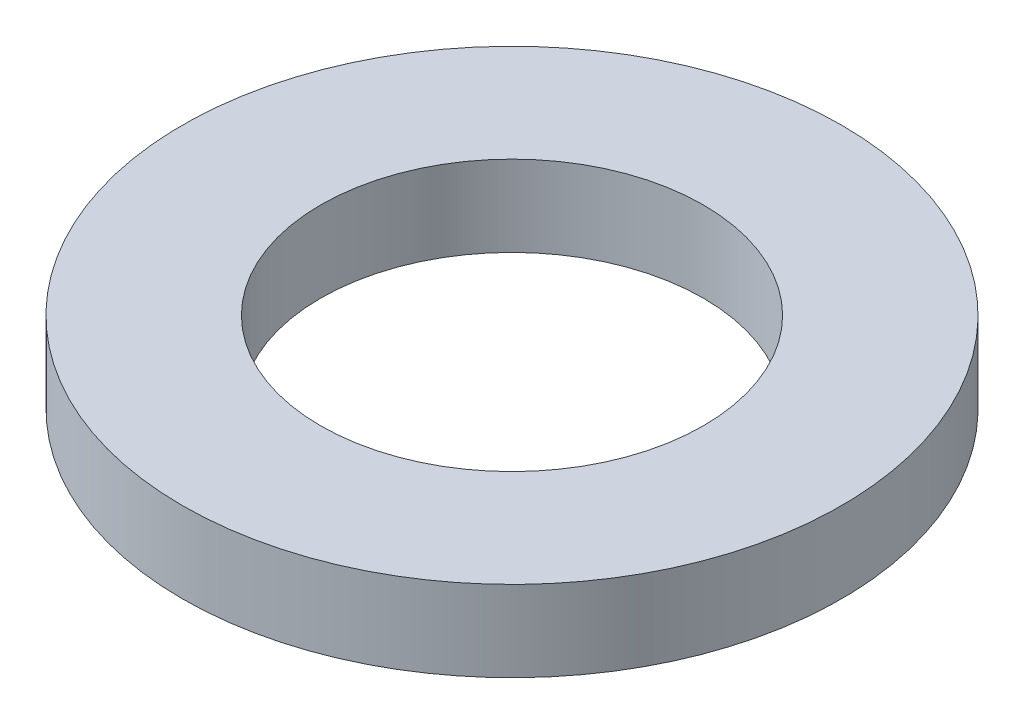
from build123d import *

# Parameters (mm, degrees)
SKETCH1_R           = 77.5
BOSS_EXTRUDE1_DEPTH = 19
SKETCH2_R           = 45
CUT_EXTRUDE1_DEPTH  = 112.236235103


with BuildPart() as part:
    # Sketch1 → Boss-Extrude1 (new body)
    with BuildSketch(Plane(origin=(0, 0, 0), x_dir=(1, 0, 0), z_dir=(0, 1, 0))):
        Circle(SKETCH1_R)
    extrude(amount=BOSS_EXTRUDE1_DEPTH)

    # Sketch2 → Cut-Extrude1 (cut, through all)
    with BuildSketch(Plane(origin=(0, 0, 0), x_dir=(1, 0, 0), z_dir=(0, 1, 0))):
        Circle(SKETCH2_R)
    extrude(amount=CUT_EXTRUDE1_DEPTH, mode=Mode.SUBTRACT)


solid = part.part
